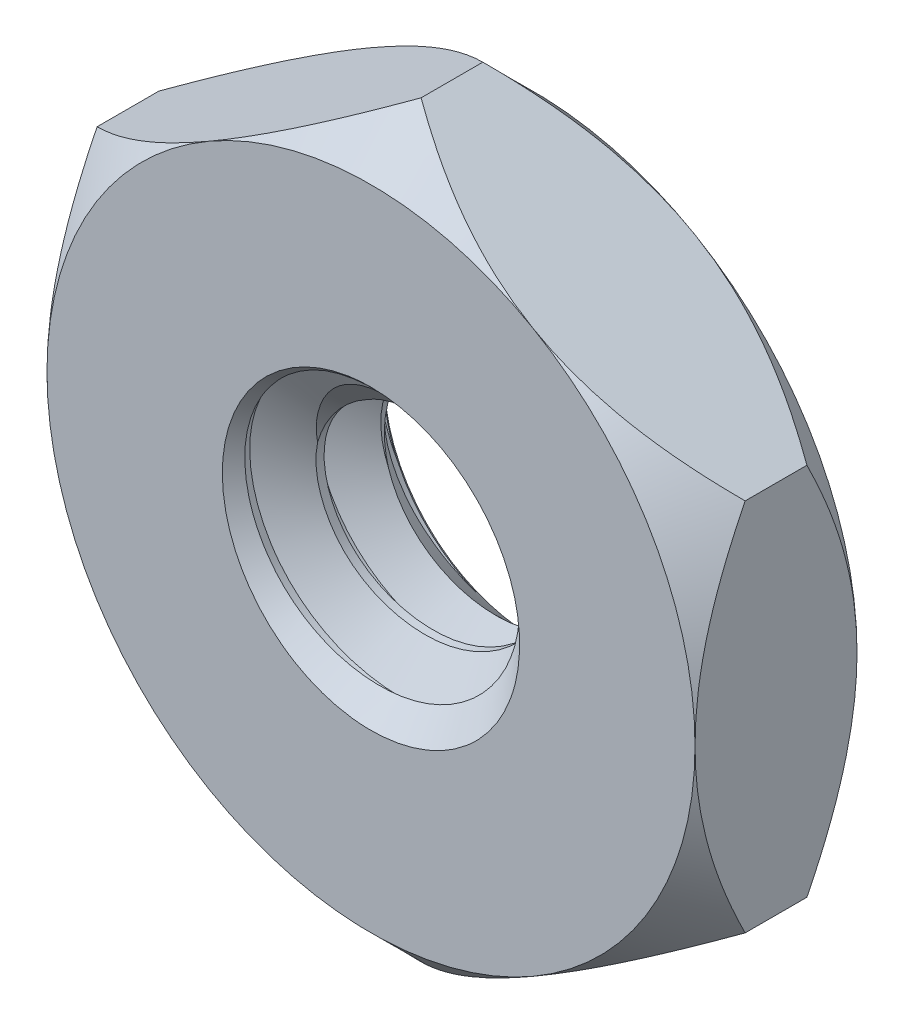
from build123d import *

# Parameters (mm, degrees)
BOSS_EXTRUDE1_DEPTH      = 0.79375
BOSS_EXTRUDE1_DEPTH_BACK = 0.79375
SKETCH4_R                = 1.4224
SKETCH5_OUTSIDE_W        = 30.316
SKETCH5_OUTSIDE_H        = 31.298
SKETCH5_OUTSIDE_R        = 3.175
CUT_EXTRUDE1_DEPTH       = 10
CUT_EXTRUDE1_DRAFT       = -45
SKETCH6_OUTSIDE_W        = 30.316
SKETCH6_OUTSIDE_H        = 31.298
SKETCH6_OUTSIDE_R        = 3.175
CUT_EXTRUDE2_DEPTH       = 10
CUT_EXTRUDE2_DRAFT       = -45
SWEEP1_PITCH             = 0.635


# Read off the part's stored shape, not the designer's step: Cut-Extrude3, Mirror1
with BuildPart() as part:
    # Sketch4 → Boss-Extrude1 (new, two sides: drawn at the far end of the back side and taken through both)
    with BuildSketch(Plane.XY.offset(-BOSS_EXTRUDE1_DEPTH_BACK)):
        Polygon((0, 3.666174209), (-3.175, 1.833087105), (-3.175, -1.833087105), (0, -3.666174209), (3.175, -1.833087105), (3.175, 1.833087105), align=None)
        Circle(SKETCH4_R, mode=Mode.SUBTRACT)
    extrude(amount=BOSS_EXTRUDE1_DEPTH + BOSS_EXTRUDE1_DEPTH_BACK)


with BuildPart() as cut_extrude1_tool:
    # Sketch5 outside → Cut-Extrude1 (with draft: the straight prism first)
    with BuildSketch(Plane.XY.offset(0.79375)):
        Rectangle(SKETCH5_OUTSIDE_W, SKETCH5_OUTSIDE_H)
        Circle(SKETCH5_OUTSIDE_R, mode=Mode.SUBTRACT)
    extrude(amount=-CUT_EXTRUDE1_DEPTH)
    # Cut-Extrude1: the draft: its side faces are tilted about the plane it starts from
    cut_extrude1_sides = [cut_extrude1_tool.faces().sort_by_distance(p)[0] for p in [
        (0, -15.649, -4.20625),
        (15.158, 0, -4.20625),
        (0, 15.649, -4.20625),
        (-15.158, 0, -4.20625),
        (-3.175, 0, -4.20625),
    ]]
    draft(cut_extrude1_sides, Plane.XY.offset(0.79375), CUT_EXTRUDE1_DRAFT)


with BuildPart() as part_1:
    add(part.part)

    # Cut-Extrude1: cut by cut_extrude1_tool
    add(cut_extrude1_tool.part, mode=Mode.SUBTRACT)


with BuildPart() as cut_extrude2_tool:
    # Sketch6 outside → Cut-Extrude2 (with draft: the straight prism first)
    with BuildSketch(Plane(origin=(0, 0, -0.79375), x_dir=(-1, 0, 0), z_dir=(0, 0, -1))):
        Rectangle(SKETCH6_OUTSIDE_W, SKETCH6_OUTSIDE_H)
        Circle(SKETCH6_OUTSIDE_R, mode=Mode.SUBTRACT)
    extrude(amount=-CUT_EXTRUDE2_DEPTH)
    # Cut-Extrude2: the draft: its side faces are tilted about the plane it starts from
    cut_extrude2_sides = [cut_extrude2_tool.faces().sort_by_distance(p)[0] for p in [
        (0, -15.649, 4.20625),
        (-15.158, 0, 4.20625),
        (0, 15.649, 4.20625),
        (15.158, 0, 4.20625),
        (3.175, 0, 4.20625),
    ]]
    draft(cut_extrude2_sides, Plane(origin=(0, 0, -0.79375), x_dir=(-1, 0, 0), z_dir=(0, 0, -1)), CUT_EXTRUDE2_DRAFT)


with BuildPart() as part_2:
    add(part_1.part)

    # Cut-Extrude2: cut by cut_extrude2_tool
    add(cut_extrude2_tool.part, mode=Mode.SUBTRACT)

    # Sweep1: the profile of Sketch9 screwed along a left-hand helix of 3.5 turns, 6 arcs to a turn; built about Z, then put on its axis
    sweep1_z = Axis((0, 0, 0), (0, 0, 1))
    sweep1_corners = [(1.456770383, 0, -0.57546875), (1.456770383, 0, 0.01984375), (1.009955401, 0, -0.238125), (1.009955401, 0, -0.3175)]
    with BuildLine(mode=Mode.PRIVATE) as sweep1_profile:
        Line(sweep1_corners[0], sweep1_corners[1])
        Line(sweep1_corners[1], sweep1_corners[2])
        Line(sweep1_corners[2], sweep1_corners[3])
        Line(sweep1_corners[3], sweep1_corners[0])
    sweep1_cap = Face(sweep1_profile.wire())
    sweep1_turn_angles = [0, -30, -60, -90, -120, -150, -180, -210, -240, -270, -300, -330, -360]
    sweep1_turn_weights = [1, 0.8660254037844387, 1, 0.8660254037844387, 1, 0.8660254037844387, 1, 0.8660254037844387, 1, 0.8660254037844387, 1, 0.8660254037844387, 1]
    sweep1_turn_rails = [Edge.make_bspline([Vector(p[0], p[1], 0).rotate(sweep1_z, sweep1_turn_angles[k]) / sweep1_turn_weights[k] + Vector(0, 0, p[2] + -SWEEP1_PITCH * sweep1_turn_angles[k] / 360) for k in range(13)], [0, 0, 0, 1, 1, 2, 2, 3, 3, 4, 4, 5, 5, 6, 6, 6], 2, sweep1_turn_weights) for p in sweep1_corners]
    sweep1_turn_sides = [Face.make_surface_from_curves(sweep1_turn_rails[p[0]], sweep1_turn_rails[p[1]]) for p in [(0, 1), (1, 2), (2, 3), (3, 0)]]
    sweep1_last_angles = [-1080, -1110, -1140, -1170, -1200, -1230, -1260]
    sweep1_last_weights = [1, 0.8660254037844387, 1, 0.8660254037844387, 1, 0.8660254037844287, 1]
    sweep1_last_rails = [Edge.make_bspline([Vector(p[0], p[1], 0).rotate(sweep1_z, sweep1_last_angles[k]) / sweep1_last_weights[k] + Vector(0, 0, p[2] + -SWEEP1_PITCH * sweep1_last_angles[k] / 360) for k in range(7)], [0, 0, 0, 1, 1, 2, 2, 3, 3, 3], 2, sweep1_last_weights) for p in sweep1_corners]
    sweep1_last_sides = [Face.make_surface_from_curves(sweep1_last_rails[p[0]], sweep1_last_rails[p[1]]) for p in [(0, 1), (1, 2), (2, 3), (3, 0)]]
    sweep1 = Plane(origin=(0, 0, 0.79375), x_dir=(0, 1, 0), z_dir=(0, 0, -1)) * Solid(Shell([*[p.moved(Location((0, 0, SWEEP1_PITCH * i))) for i in range(3) for p in sweep1_turn_sides], *sweep1_last_sides, sweep1_cap, sweep1_cap.rotate(sweep1_z, -1260).moved(Location((0, 0, -SWEEP1_PITCH * -1260 / 360)))]))
    add(sweep1)

    # Cut-Extrude3 outline → Cut-Extrude3 (revolve, cut)
    with BuildSketch(Plane.XZ):
        Polygon((1.00995184, 0.346931457), (1.456778279, 0.793757896), (1.456778279, 1.36921885), (1.00995184, 1.36921885), align=None)
    revolve(axis=Axis((0, 0, 0), (0, 0, 1)), mode=Mode.SUBTRACT)

    # Mirror1 outline → Mirror1 (revolve, cut)
    with BuildSketch(Plane.XZ):
        Polygon((1.456771489, -0.793751106), (1.009952808, -0.346932425), (1.009952808, -1.44859385), (1.456771489, -1.44859385), align=None)
    revolve(axis=Axis((0, 0, 0), (0, 0, 1)), mode=Mode.SUBTRACT)


solid = part_2.part
